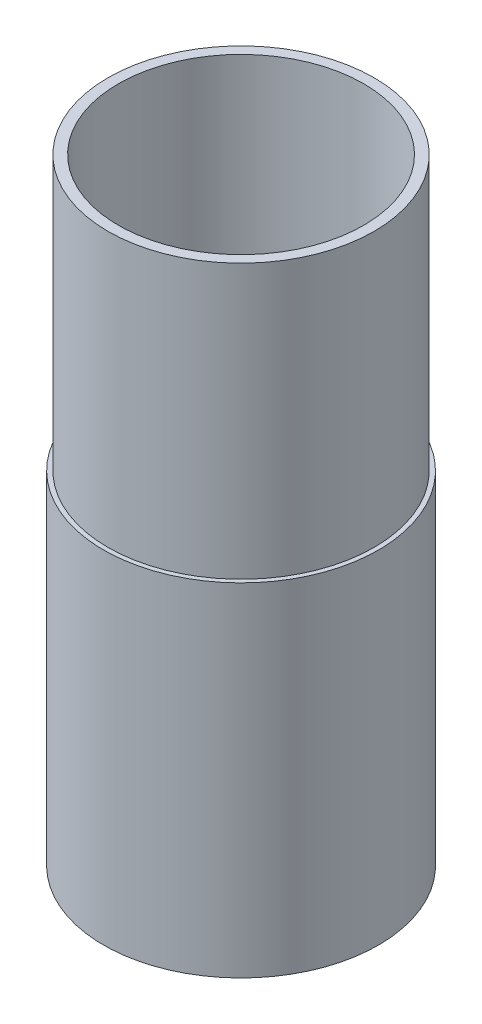
from build123d import *


with BuildPart() as part:
    # Sketch1 → Revolve1 (revolve)
    with BuildSketch(Plane.XY):
        Polygon((22.762367851, 58.026263883), (22.762367851, -56.273736117), (25.5143, -56.273736117), (25.5143, 7.226263883), (24.692767851, 7.226263883), (24.692767851, 58.026263883), align=None)
    revolve(axis=Axis((0, 0, 0), (0, 1, 0)))


solid = part.part
